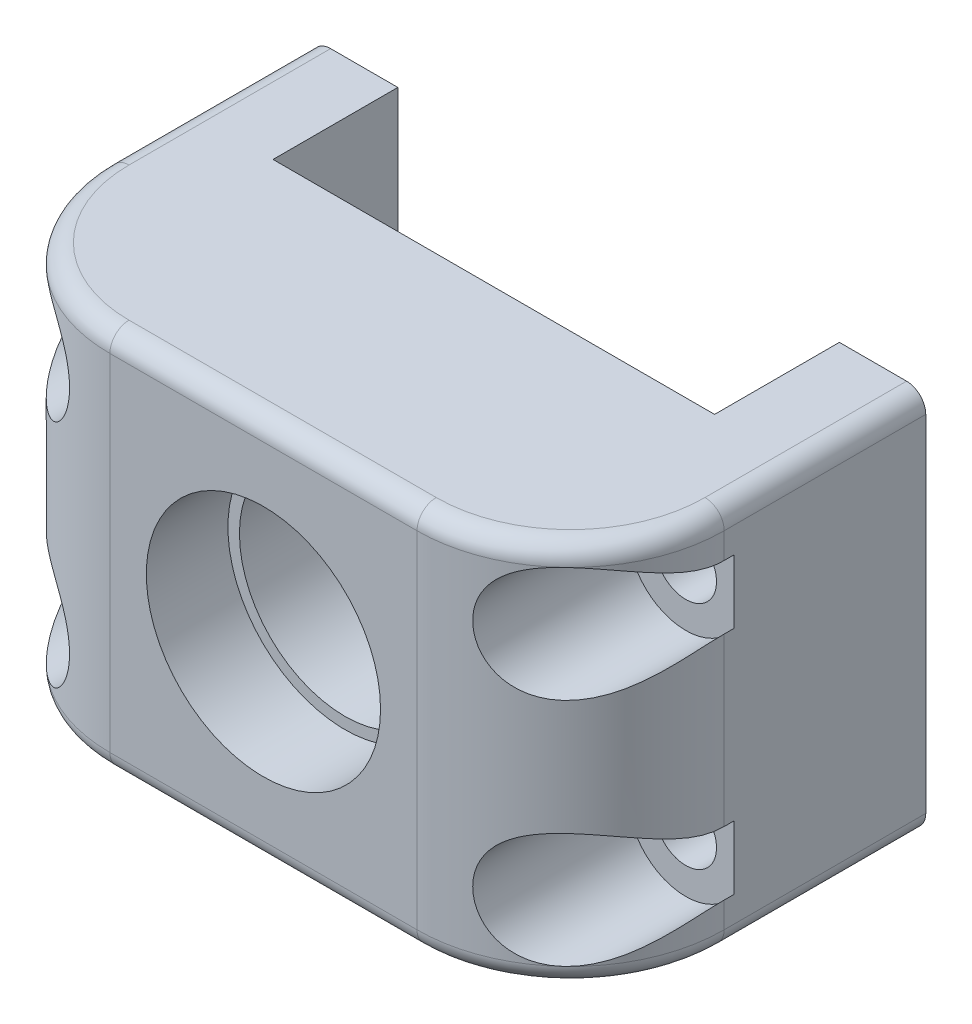
from build123d import *

# Parameters (mm, degrees)
SKETCH3_W           = 32
SKETCH3_H           = 20
SKETCH3_R           = 1.6
BOSS_EXTRUDE1_DEPTH = 18.5
CUT_EXTRUDE1_REACH  = 33.595
SKETCH5_W           = 23
SKETCH5_H           = 6.5
FILLET2_START       = -11
FILLET2_DEPTH       = 22
FILLET1_R           = 1
CUT_EXTRUDE5_REACH  = 38.424
CUT_EXTRUDE5_START  = -10
SKETCH9_R           = 3
SKETCH10_R          = 6.1
CUT_EXTRUDE6_DEPTH  = 4.25
CUT_EXTRUDE7_START  = -3.5
SKETCH12_R          = 6.1
CUT_EXTRUDE7_DEPTH  = 3.5
CUT_EXTRUDE8_REACH  = 23.354
SKETCH13_R          = 5.5


with BuildPart() as part:
    # Sketch3 → Boss-Extrude1 (new body)
    with BuildSketch(Plane.XY):
        Rectangle(SKETCH3_W, SKETCH3_H)
        with Locations((-13.5, 6)):
            Circle(SKETCH3_R, mode=Mode.SUBTRACT)
        with Locations((-13.5, -6)):
            Circle(SKETCH3_R, mode=Mode.SUBTRACT)
        with Locations((13.5, -6)):
            Circle(SKETCH3_R, mode=Mode.SUBTRACT)
        with Locations((13.5, 6)):
            Circle(SKETCH3_R, mode=Mode.SUBTRACT)
    extrude(amount=BOSS_EXTRUDE1_DEPTH)

    # Sketch5 → Cut-Extrude1 (cut, up to next)
    with BuildSketch(Plane(origin=(0, 10, 0), x_dir=(1, 0, 0), z_dir=(0, 1, 0)), mode=Mode.PRIVATE) as cut_extrude1_sk1:
        with Locations((0, -3.25)):
            Rectangle(SKETCH5_W, SKETCH5_H)
    cut_extrude1_tool1 = extrude(cut_extrude1_sk1.sketch, amount=-CUT_EXTRUDE1_REACH, mode=Mode.PRIVATE) & part.part
    add(cut_extrude1_tool1.solids().sort_by_distance((0, 10, 3.25))[0], mode=Mode.SUBTRACT)

    # Fillet2: read off the stored shape, not the designer's step
    # Fillet2 outline → Fillet2 (cut)
    with BuildSketch(Plane(origin=(0, 0, 0), x_dir=(1, 0, 0), z_dir=(0, 1, 0)).offset(FILLET2_START)):
        with BuildLine():
            ThreePointArc((16, -10.5), (13.656854249, -16.156854249), (8, -18.5))
            Line((8, -18.5), (16, -18.5))
            Line((16, -18.5), (16, -10.5))
        make_face()
        with BuildLine():
            Line((-16, -18.5), (-8, -18.5))
            ThreePointArc((-8, -18.5), (-13.656854249, -16.156854249), (-16, -10.5))
            Line((-16, -10.5), (-16, -18.5))
        make_face()
    extrude(amount=FILLET2_DEPTH, mode=Mode.SUBTRACT)

    # Fillet1
    fillet1_edges = [part.edges().sort_by_distance(p)[0] for p in [
        (0, 10, 18.5),
        (0, -10, 18.5),
        (-16, 10, 5.25),
        (16, 10, 5.25),
        (-13.656854249, 10, 16.156854249),
        (13.656854249, 10, 16.156854249),
        (16, -10, 5.25),
        (-16, -10, 5.25),
        (-13.656854249, -10, 16.156854249),
        (13.656854249, -10, 16.156854249),
    ]]
    fillet(fillet1_edges, radius=FILLET1_R)

    # Sketch9 → Cut-Extrude5 (cut, up to next)
    with BuildSketch(Plane(origin=(0, 0, 0), x_dir=(-1, 0, 0), z_dir=(0, 0, -1)).offset(CUT_EXTRUDE5_START), mode=Mode.PRIVATE) as cut_extrude5_sk1:
        with Locations((-13.5, 6)):
            Circle(SKETCH9_R)
    cut_extrude5_tool1 = extrude(cut_extrude5_sk1.sketch, amount=-CUT_EXTRUDE5_REACH, mode=Mode.PRIVATE) & part.part
    # Sketch9 → Cut-Extrude5 (cut, up to next)
    with BuildSketch(Plane(origin=(0, 0, 0), x_dir=(-1, 0, 0), z_dir=(0, 0, -1)).offset(CUT_EXTRUDE5_START), mode=Mode.PRIVATE) as cut_extrude5_sk2:
        with Locations((-13.5, -6)):
            Circle(SKETCH9_R)
    cut_extrude5_tool2 = extrude(cut_extrude5_sk2.sketch, amount=-CUT_EXTRUDE5_REACH, mode=Mode.PRIVATE) & part.part
    # Sketch9 → Cut-Extrude5 (cut, up to next)
    with BuildSketch(Plane(origin=(0, 0, 0), x_dir=(-1, 0, 0), z_dir=(0, 0, -1)).offset(CUT_EXTRUDE5_START), mode=Mode.PRIVATE) as cut_extrude5_sk3:
        with Locations((13.5, -6)):
            Circle(SKETCH9_R)
    cut_extrude5_tool3 = extrude(cut_extrude5_sk3.sketch, amount=-CUT_EXTRUDE5_REACH, mode=Mode.PRIVATE) & part.part
    # Sketch9 → Cut-Extrude5 (cut, up to next)
    with BuildSketch(Plane(origin=(0, 0, 0), x_dir=(-1, 0, 0), z_dir=(0, 0, -1)).offset(CUT_EXTRUDE5_START), mode=Mode.PRIVATE) as cut_extrude5_sk4:
        with Locations((13.5, 6)):
            Circle(SKETCH9_R)
    cut_extrude5_tool4 = extrude(cut_extrude5_sk4.sketch, amount=-CUT_EXTRUDE5_REACH, mode=Mode.PRIVATE) & part.part
    add(cut_extrude5_tool1.solids().sort_by_distance((13.5, 6, 10))[0], mode=Mode.SUBTRACT)
    add(cut_extrude5_tool2.solids().sort_by_distance((13.5, -6, 10))[0], mode=Mode.SUBTRACT)
    add(cut_extrude5_tool3.solids().sort_by_distance((-13.5, -6, 10))[0], mode=Mode.SUBTRACT)
    add(cut_extrude5_tool4.solids().sort_by_distance((-13.5, 6, 10))[0], mode=Mode.SUBTRACT)

    # Sketch10 → Cut-Extrude6 (cut)
    with BuildSketch(Plane.XY.offset(18.5)):
        Circle(SKETCH10_R)
    extrude(amount=-CUT_EXTRUDE6_DEPTH, mode=Mode.SUBTRACT)

    # Sketch12 → Cut-Extrude7 (cut)
    with BuildSketch(Plane(origin=(0, 0, 6.5), x_dir=(-1, 0, 0), z_dir=(0, 0, -1)).offset(CUT_EXTRUDE7_START)):
        with Locations(Location((0, 0, 0), (0, 0, 180))):
            Circle(SKETCH12_R)
    extrude(amount=CUT_EXTRUDE7_DEPTH, mode=Mode.SUBTRACT)

    # Sketch13 → Cut-Extrude8 (cut, up to next)
    with BuildSketch(Plane(origin=(0, 0, 10), x_dir=(-1, 0, 0), z_dir=(0, 0, -1)), mode=Mode.PRIVATE) as cut_extrude8_sk1:
        Circle(SKETCH13_R)
    cut_extrude8_tool1 = extrude(cut_extrude8_sk1.sketch, amount=-CUT_EXTRUDE8_REACH, mode=Mode.PRIVATE) & part.part
    add(cut_extrude8_tool1.solids().sort_by_distance((0, 0, 10))[0], mode=Mode.SUBTRACT)


solid = part.part
